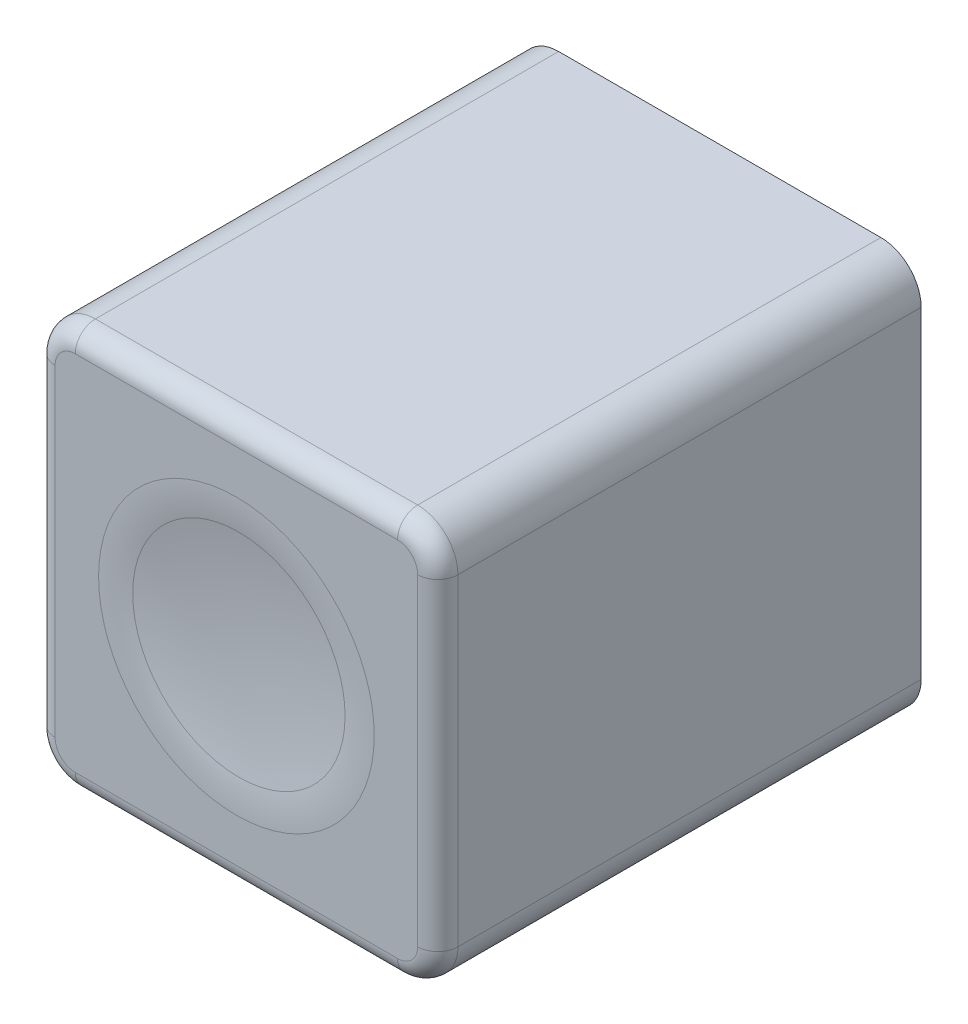
from build123d import *

# Parameters (mm, degrees)
EXTRUDE_1_DEPTH      = 5
EXTRUDE_1_DEPTH_BACK = 7
SKETCH_1_W           = 10
SKETCH_1_H           = 10
FILLET_1_R           = 1
FILLET_2_R           = 0.5
FILLET_3_R           = 5


with BuildPart() as part:
    # Эскиз1 → Бобышка-Вытянуть1 (new, two sides: drawn at the far end of the back side and taken through both)
    with BuildSketch(Plane.XY.offset(-3).offset(-EXTRUDE_1_DEPTH_BACK)):
        Rectangle(SKETCH_1_W, SKETCH_1_H)
    extrude(amount=EXTRUDE_1_DEPTH + EXTRUDE_1_DEPTH_BACK)

    # Скругление1
    fillet_1_edges = [part.edges().sort_by_distance(p)[0] for p in [
        (5, -5, -4),
        (-5, -5, -4),
        (-5, 5, -4),
        (5, 5, -4),
    ]]
    fillet(fillet_1_edges, radius=FILLET_1_R)

    # Скругление2
    fillet_2_edges = [part.edges().sort_by_distance(p)[0] for p in [
        (-4.707106781, -4.707106781, 2),
        (-5, 0, 2),
        (-4.707106781, 4.707106781, 2),
        (0, 5, 2),
        (4.707106781, 4.707106781, 2),
        (5, 0, 2),
        (4.707106781, -4.707106781, 2),
        (0, -5, 2),
    ]]
    fillet(fillet_2_edges, radius=FILLET_2_R)

    # Эскиз2 → Вырез-Повернуть2 (revolve, cut)
    with BuildSketch(Plane(origin=(0, 0, 0), x_dir=(0, 0, -1), z_dir=(1, 0, 0))):
        with BuildLine():
            ThreePointArc((-1.729490169, 0), (-1.797254534, 1.506085619), (-2, 3))
            Line((-2, 3), (-2, 0))
            Line((-2, 0), (-1.729490169, 0))
        make_face()
    revolve(axis=Axis((0, 0, 0), (0, 0, 1)), mode=Mode.SUBTRACT)

    # Скругление3
    fillet_3_edges = [part.edges().sort_by_distance(p)[0] for p in [
        (0, -3, 2),
    ]]
    fillet(fillet_3_edges, radius=FILLET_3_R)


solid = part.part
